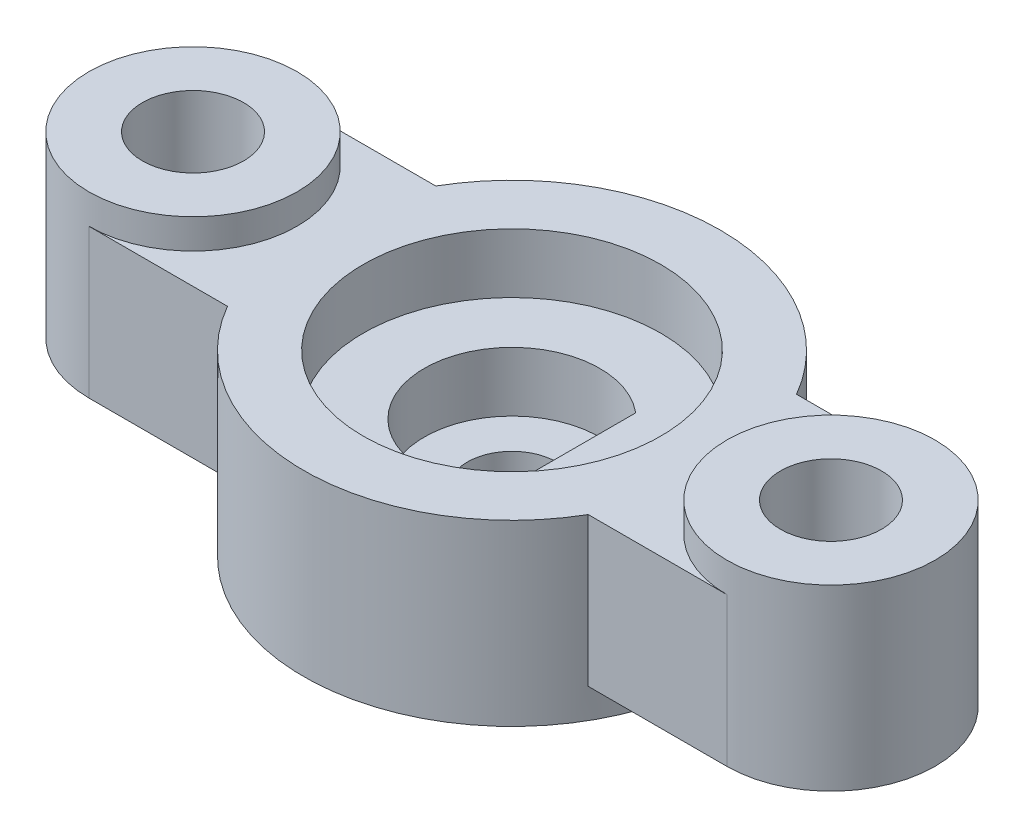
from build123d import *

# Parameters (mm, degrees)
ESQUISSE1_R             = 5
ESQUISSE1_R_2           = 1.7
BOSS_EXTRU_1_DEPTH      = 5
ESQUISSE2_R             = 3.5
ESQUISSE2_R_2           = 1.7
BOSS_EXTRU_2_DEPTH      = 1
BOSS_EXTRU_3_DEPTH      = 1
BOSS_EXTRU_3_DEPTH_BACK = 3
ESQUISSE3_R             = 7
ESQUISSE3_R_2           = 1.5
ENL_V_MAT_EXTRU_1_DEPTH = 2


with BuildPart() as part:
    # Esquisse1 → Boss.-Extru.1 (new body)
    with BuildSketch(Plane(origin=(0, 0, 0), x_dir=(1, 0, 0), z_dir=(0, 1, 0))):
        with BuildLine():
            Line((-10.72, 3.5), (-6.062177826, 3.5))
            ThreePointArc((-6.062177826, 3.5), (0, 7), (6.062177826, 3.5))
            Line((6.062177826, 3.5), (10.72, 3.5))
            ThreePointArc((10.72, 3.5), (14.22, 0), (10.72, -3.5))
            Line((10.72, -3.5), (6.062177826, -3.5))
            ThreePointArc((6.062177826, -3.5), (0, -7), (-6.062177826, -3.5))
            Line((-6.062177826, -3.5), (-10.72, -3.5))
            ThreePointArc((-10.72, -3.5), (-14.22, 0), (-10.72, 3.5))
        make_face()
        Circle(ESQUISSE1_R, mode=Mode.SUBTRACT)
        with Locations((10.72, 0)):
            Circle(ESQUISSE1_R_2, mode=Mode.SUBTRACT)
        with Locations((-10.72, 0)):
            Circle(ESQUISSE1_R_2, mode=Mode.SUBTRACT)
    extrude(amount=BOSS_EXTRU_1_DEPTH)

    # Esquisse2 → Boss.-Extru.2 (add)
    # profile 1 of 2: a face of its own
    with BuildSketch(Plane(origin=(0, 5, 0), x_dir=(1, 0, 0), z_dir=(0, 1, 0))):
        with Locations((-10.72, 0)):
            Circle(ESQUISSE2_R)
        with Locations((-10.72, 0)):
            Circle(ESQUISSE2_R_2, mode=Mode.SUBTRACT)
    # profile 2 of 2: a face of its own
    with BuildSketch(Plane(origin=(0, 5, 0), x_dir=(1, 0, 0), z_dir=(0, 1, 0))):
        with Locations((10.72, 0)):
            Circle(ESQUISSE2_R)
        with Locations((10.72, 0)):
            Circle(ESQUISSE2_R_2, mode=Mode.SUBTRACT)
    extrude(amount=BOSS_EXTRU_2_DEPTH)

    # Esquisse3 → Boss.-Extru.3 (add, two sides: drawn at the far end of the back side and taken through both)
    with BuildSketch(Plane.XZ.offset(-BOSS_EXTRU_3_DEPTH_BACK)):
        Circle(ESQUISSE3_R)
        Circle(ESQUISSE3_R_2, mode=Mode.SUBTRACT)
    extrude(amount=BOSS_EXTRU_3_DEPTH + BOSS_EXTRU_3_DEPTH_BACK)

    # Esquisse6 → Enlèv. mat.-Extru.1 (cut)
    with BuildSketch(Plane(origin=(0, 3, 0), x_dir=(1, 0, 0), z_dir=(0, 1, 0))):
        with BuildLine():
            Line((1.9, 2.256656819), (1.9, -2.256656819))
            ThreePointArc((1.9, -2.256656819), (-2.95, 0), (1.9, 2.256656819))
        make_face()
    extrude(amount=-ENL_V_MAT_EXTRU_1_DEPTH, mode=Mode.SUBTRACT)


solid = part.part
